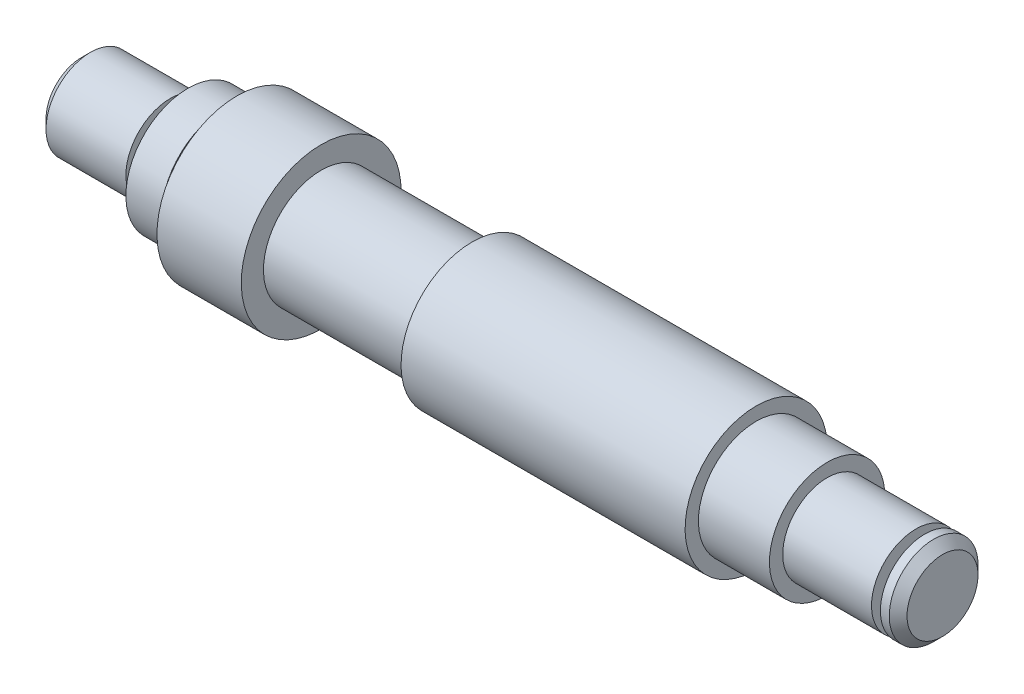
from build123d import *

# Parameters (mm, degrees)
CHAMFER1_SIZE = 0.5


with BuildPart() as part:
    # Sketch1 → Revolve1 (revolve)
    with BuildSketch(Plane.XY):
        Polygon((0, 0), (0, 2.5), (-1, 2.5), (-1, 1.5), (-1.5, 1.5), (-1.5, 2.5), (-6.5, 2.5), (-6.5, 3.25), (-10.5, 3.25), (-10.5, 4), (-26.5, 4), (-26.5, 3.25), (-35, 3.25), (-35, 4.5), (-39.75, 4.5), (-39.75, 3), (-40.5, 3), (-40.5, 3.5), (-42.5, 3.5), (-42.5, 2), (-43.5, 2), (-43.5, 2.5), (-48.5, 2.5), (-48.5, 0), align=None)
    revolve(axis=Axis((0, 0, 0), (-1, 0, 0)))

    # Chamfer1
    chamfer1_edges = [part.edges().sort_by_distance(p)[0] for p in [
        (0, -2.5, 0),
        (-48.5, -2.5, 0),
    ]]
    chamfer(chamfer1_edges, length=CHAMFER1_SIZE)


solid = part.part
